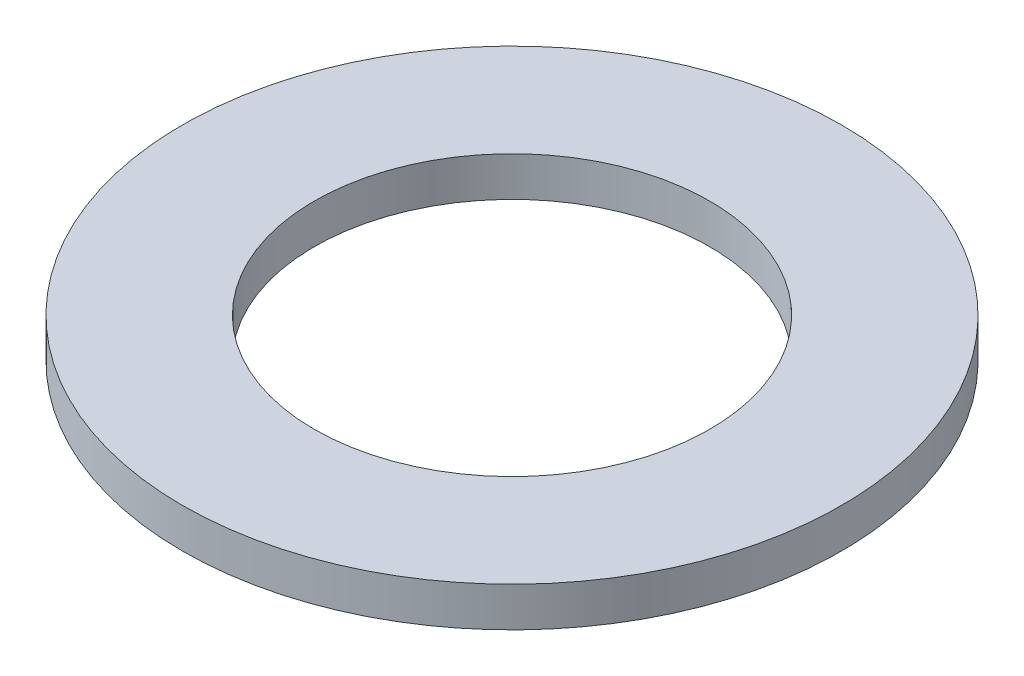
from build123d import *

# Parameters (mm, degrees)
SKETCH1_R           = 2.5
SKETCH1_R_2         = 1.5
BOSS_EXTRUDE1_DEPTH = 0.3


with BuildPart() as part:
    # Sketch1 → Boss-Extrude1 (new body)
    with BuildSketch(Plane(origin=(0, 0, 0), x_dir=(1, 0, 0), z_dir=(0, 1, 0))):
        Circle(SKETCH1_R)
        Circle(SKETCH1_R_2, mode=Mode.SUBTRACT)
    extrude(amount=BOSS_EXTRUDE1_DEPTH)


solid = part.part
